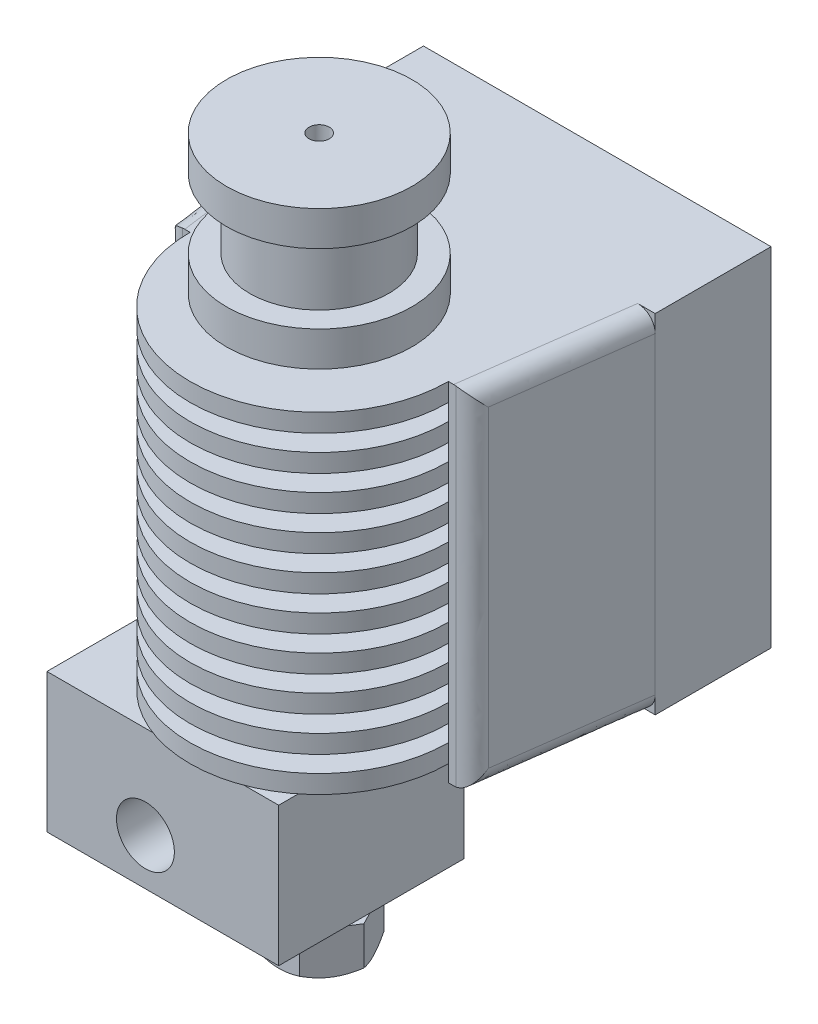
from build123d import *

# Parameters (mm, degrees)
EXTRUDE_1_DEPTH     = 6
SKETCH_2_R          = 2
EXTRUDE_2_DEPTH     = 14
SKETCH_3_R          = 11.15
EXTRUDE_3_DEPTH     = 30
SKETCH_4_R          = 2.5
EXTRUDE_4_DEPTH     = 1
SKETCH_5_R          = 8
EXTRUDE_5_DEPTH     = 3
SKETCH_6_R          = 6
EXTRUDE_6_DEPTH     = 6
SKETCH_7_R          = 8
EXTRUDE_7_DEPTH     = 3
SKETCH_8_W          = 6.5
SKETCH_8_H          = 1.428041857
SKETCH_9_W          = 20
SKETCH_9_H          = 16
EXTRUDE_8_DEPTH     = 12
SKETCH_11_R         = 2.5
CUT_EXTRUDE_1_DEPTH = 68.645934837
SKETCH_12_R         = 0.875
CUT_EXTRUDE_2_DEPTH = 60
EXTRUDE_9_DEPTH     = 30
FILLET_1_R          = 1.5
SKETCH_16_W         = 30
SKETCH_16_H         = 30
EXTRUDE_10_DEPTH    = 10
SKETCH_17_R         = 13
CUT_EXTRUDE_5_DEPTH = 5


with BuildPart() as part:
    # 草图1 → 凸台-拉伸1 (new body)
    with BuildSketch(Plane(origin=(0, 0, 0), x_dir=(1, 0, 0), z_dir=(0, 1, 0))):
        Polygon((1.866885727, -3.584420597), (4.037642158, -0.175439832), (2.170756431, 3.408980764), (-1.866885727, 3.584420597), (-4.037642158, 0.175439832), (-2.170756431, -3.408980764), align=None)
    extrude(amount=EXTRUDE_1_DEPTH)

    # 草图2 → 凸台-拉伸2 (add)
    with BuildSketch(Plane(origin=(0, 6, 0), x_dir=(1, 0, 0), z_dir=(0, 1, 0))):
        Circle(SKETCH_2_R)
    extrude(amount=EXTRUDE_2_DEPTH)

    # 草图3 → 凸台-拉伸3 (add)
    with BuildSketch(Plane(origin=(0, 20, 0), x_dir=(1, 0, 0), z_dir=(0, 1, 0))):
        Circle(SKETCH_3_R)
    extrude(amount=EXTRUDE_3_DEPTH)

    # 草图4 → 凸台-拉伸4 (add)
    with BuildSketch(Plane(origin=(0, 50, 0), x_dir=(1, 0, 0), z_dir=(0, 1, 0))):
        Circle(SKETCH_4_R)
    extrude(amount=EXTRUDE_4_DEPTH)

    # 草图5 → 凸台-拉伸5 (add)
    with BuildSketch(Plane(origin=(0, 51, 0), x_dir=(1, 0, 0), z_dir=(0, 1, 0))):
        Circle(SKETCH_5_R)
    extrude(amount=EXTRUDE_5_DEPTH)

    # 草图6 → 凸台-拉伸6 (add)
    with BuildSketch(Plane(origin=(0, 54, 0), x_dir=(1, 0, 0), z_dir=(0, 1, 0))):
        Circle(SKETCH_6_R)
    extrude(amount=EXTRUDE_6_DEPTH)

    # 草图7 → 凸台-拉伸7 (add)
    with BuildSketch(Plane(origin=(0, 60, 0), x_dir=(1, 0, 0), z_dir=(0, 1, 0))):
        Circle(SKETCH_7_R)
    extrude(amount=EXTRUDE_7_DEPTH)

    # 草图8 → 切除-旋转3 (revolve, cut)
    with BuildSketch(Plane.XY):
        with Locations((-7.912567894, 20.714020928)):
            Rectangle(SKETCH_8_W, SKETCH_8_H)
        with Locations((-7.912567894, 23.714020928)):
            Rectangle(SKETCH_8_W, SKETCH_8_H)
        with Locations((-7.912567894, 26.714020928)):
            Rectangle(SKETCH_8_W, SKETCH_8_H)
        with Locations((-7.912567894, 29.714020929)):
            Rectangle(SKETCH_8_W, SKETCH_8_H)
        with Locations((-7.912567894, 32.714020929)):
            Rectangle(SKETCH_8_W, SKETCH_8_H)
        with Locations((-7.912567894, 35.714020929)):
            Rectangle(SKETCH_8_W, SKETCH_8_H)
        with Locations((-7.912567894, 38.714020929)):
            Rectangle(SKETCH_8_W, SKETCH_8_H)
        with Locations((-7.912567894, 41.714020929)):
            Rectangle(SKETCH_8_W, SKETCH_8_H)
        with Locations((-7.912567894, 44.714020929)):
            Rectangle(SKETCH_8_W, SKETCH_8_H)
        with Locations((-7.912567894, 47.714020929)):
            Rectangle(SKETCH_8_W, SKETCH_8_H)
    revolve(axis=Axis((0, 50, 0), (0, -1, 0)), mode=Mode.SUBTRACT)

    # 草图9 → 凸台-拉伸8 (add)
    with BuildSketch(Plane(origin=(0, 7, 0), x_dir=(1, 0, 0), z_dir=(0, 1, 0))):
        with Locations((-5.5, 0)):
            Rectangle(SKETCH_9_W, SKETCH_9_H)
    extrude(amount=EXTRUDE_8_DEPTH)

    # 草图10 → 切除-旋转4 (revolve, cut)
    with BuildSketch(Plane.XY):
        Polygon((-0.2, 0), (-5.2, 3.5), (-5.2, 0), align=None)
    revolve(axis=Axis((0, 20, 0), (0, -1, 0)), mode=Mode.SUBTRACT)

    # 草图11 → 切除-拉伸1 (cut, through all)
    with BuildSketch(Plane.XY.offset(8)):
        with Locations((-7, 11)):
            Circle(SKETCH_11_R)
    extrude(amount=-CUT_EXTRUDE_1_DEPTH, mode=Mode.SUBTRACT)

    # 草图12 → 切除-拉伸2 (cut)
    with BuildSketch(Plane(origin=(0, 63, 0), x_dir=(1, 0, 0), z_dir=(0, 1, 0))):
        Circle(SKETCH_12_R)
    extrude(amount=-CUT_EXTRUDE_2_DEPTH, mode=Mode.SUBTRACT)

    # 草图14 → 凸台-拉伸9 (add)
    with BuildSketch(Plane.XZ.offset(-20)):
        with BuildLine():
            Line((15, -14), (13.117053025, 0))
            Line((13.117053025, 0), (11.15, 0))
            ThreePointArc((11.15, 0), (0, -11.15), (-11.15, 0))
            Line((-11.15, 0), (-13.117053025, 0))
            Line((-13.117053025, 0), (-15, -14))
            Line((-15, -14), (15, -14))
        make_face()
    extrude(amount=-EXTRUDE_9_DEPTH)

    # 变化圆角1
    fillet_1_edges = [part.edges().sort_by_distance(p)[0] for p in [
        (-13.117053025, 35, 0),
        (13.117053025, 35, 0),
        (-14.058526513, 20, -7),
        (-14.058526513, 50, -7),
        (14.058526513, 20, -7),
        (14.058526513, 50, -7),
    ]]
    fillet(fillet_1_edges, radius=FILLET_1_R)

    # 草图16 → 凸台-拉伸10 (add)
    with BuildSketch(Plane(origin=(0, 0, -14), x_dir=(-1, 0, 0), z_dir=(0, 0, -1))):
        with Locations((0, 35)):
            Rectangle(SKETCH_16_W, SKETCH_16_H)
    extrude(amount=EXTRUDE_10_DEPTH)

    # 草图17 → 切除-拉伸5 (cut)
    with BuildSketch(Plane(origin=(0, 0, -24), x_dir=(-1, 0, 0), z_dir=(0, 0, -1))):
        with Locations((0, 36.428041857)):
            Circle(SKETCH_17_R)
    extrude(amount=-CUT_EXTRUDE_5_DEPTH, mode=Mode.SUBTRACT)


solid = part.part
